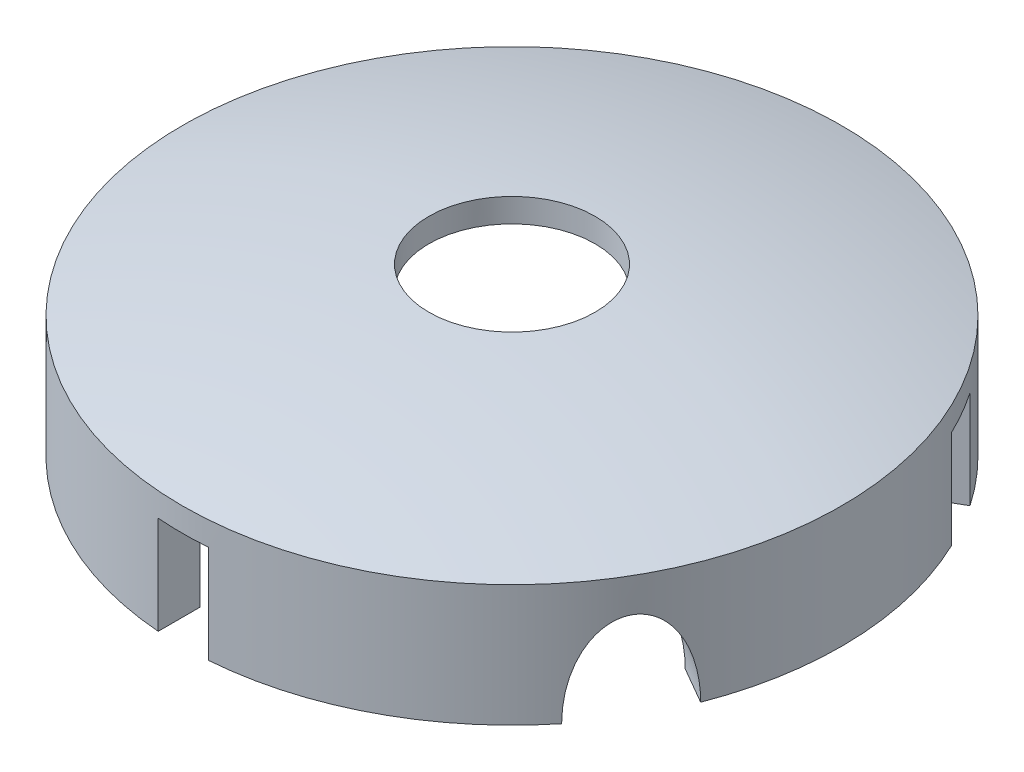
from build123d import *
from build123d.topology import SkipClean

# Parameters (mm, degrees)
SKETCH2_R           = 44.05249
BOSS_EXTRUDE1_DEPTH = 3.175
SKETCH4_R           = 44.45
SKETCH4_R_2         = 38.496875
BOSS_EXTRUDE2_DEPTH = 13.09624
SKETCH5_W           = 6.74624
SKETCH5_H           = 50.081304553
CUT_EXTRUDE1_DEPTH  = 65.211498208
CIRPATTERN1_COUNT   = 3
DOME1_FACE_RADIUS   = 44.05249
DOME1_HEIGHT        = 6.35
SKETCH11_R          = 11.1125
CUT_EXTRUDE4_DEPTH  = 65.211498208
SKETCH12_R          = 44.45
SKETCH12_R_2        = 44.05249
CUT_EXTRUDE5_DEPTH  = 67.674963897
SKETCH13_RX         = 11.739123023
SKETCH13_RY         = 6.803403928
CUT_EXTRUDE6_DEPTH  = 64.661253935
CIRPATTERN2_COUNT   = 3


# Read off the part's stored shape, not the designer's step: Shell2
with BuildPart() as part:
    # Sketch2 → Boss-Extrude1 (new body)
    with BuildSketch(Plane(origin=(0, 0, 0), x_dir=(1, 0, 0), z_dir=(0, 1, 0))):
        with Locations(Location((0, 0, 0), (0, 0, 270))):
            Circle(SKETCH2_R)
    extrude(amount=BOSS_EXTRUDE1_DEPTH)

    # Sketch4 → Boss-Extrude2 (add)
    with BuildSketch(Plane.XZ):
        with Locations(Location((0, 0, 0), (0, 0, 270))):
            Circle(SKETCH4_R)
        with Locations(Location((0, 0, 0), (0, 0, 270))):
            Circle(SKETCH4_R_2, mode=Mode.SUBTRACT)
    extrude(amount=BOSS_EXTRUDE2_DEPTH)

    # Sketch5 → Cut-Extrude1 (cut, through all)
    with BuildSketch(Plane.XZ):
        with Locations((0, 25.040652277)):
            Rectangle(SKETCH5_W, SKETCH5_H)
    cut_extrude1 = extrude(amount=CUT_EXTRUDE1_DEPTH, mode=Mode.SUBTRACT)

    # CirPattern1: Cut-Extrude1 ×3 about axis
    cirpattern1_axis = Axis((0, 0, 0), (0, 1, 0))
    for i in range(1, CIRPATTERN1_COUNT):
        add(cut_extrude1.rotate(cirpattern1_axis, i * 360 / CIRPATTERN1_COUNT), mode=Mode.SUBTRACT)

    # Dome1: a dome of height H over a round flat face of radius A is a cap of a sphere of radius (A * A + H * H) / (2 * H)
    dome1_r = (DOME1_FACE_RADIUS * DOME1_FACE_RADIUS + DOME1_HEIGHT * DOME1_HEIGHT) / (2 * DOME1_HEIGHT)
    dome1_base = Plane((0, 3.175, 0), z_dir=(0, 1, 0))
    with Locations(dome1_base.offset(DOME1_HEIGHT - dome1_r)):
        dome1_ball = Sphere(dome1_r, mode=Mode.PRIVATE)
    add(split(dome1_ball, bisect_by=dome1_base, keep=Keep.TOP, mode=Mode.PRIVATE))

    # Shell2 outline → Shell2 (revolve, cut)
    with BuildSketch(Plane.XY):
        with BuildLine():
            Line((0, 0), (40.87749, 0))
            Line((40.87749, 0), (40.877490147, 0.780856364))
            ThreePointArc((40.877490147, 0.780856364), (20.62755779, 4.951312704), (0, 6.35))
            Line((0, 6.35), (0, 0))
        make_face()
    revolve(axis=Axis((0, 0, 0), (0, 1, 0)), mode=Mode.SUBTRACT)

    # Sketch11 → Cut-Extrude4 (cut, through all)
    with BuildSketch(Plane(origin=(0, 0, 0), x_dir=(1, 0, 0), z_dir=(0, 1, 0))):
        with Locations(Location((0, 0, 0), (0, 0, 90))):
            Circle(SKETCH11_R)
    extrude(amount=CUT_EXTRUDE4_DEPTH, mode=Mode.SUBTRACT)

    # Sketch12 → Cut-Extrude5 (cut, through all)
    with SkipClean():  # the faces are left unmerged after this step: merging them gives an invalid solid
        with BuildSketch(Plane.XZ.offset(13.09624)):
            Circle(SKETCH12_R)
            with Locations(Location((0, 0, 0), (0, 0, 325.608536688))):
                Circle(SKETCH12_R_2, mode=Mode.SUBTRACT)
        extrude(amount=-CUT_EXTRUDE5_DEPTH, mode=Mode.SUBTRACT)

    # Sketch13 → Cut-Extrude6 (cut, through all)
    with SkipClean():  # the faces are left unmerged after this step: merging them gives an invalid solid
        with BuildSketch(Plane.XY):
            with Locations(Location((0, -13.09624), (0, 0, 90))):
                Ellipse(SKETCH13_RX, SKETCH13_RY)
        cut_extrude6 = extrude(amount=-CUT_EXTRUDE6_DEPTH, mode=Mode.SUBTRACT)

    # CirPattern2: Cut-Extrude6 ×3 about axis
    with SkipClean():  # the faces are left unmerged after this step: merging them gives an invalid solid
        cirpattern2_axis = Axis((0, 3.175, 0), (0, -1, 0))
        for i in range(1, CIRPATTERN2_COUNT):
            add(cut_extrude6.rotate(cirpattern2_axis, i * 360 / CIRPATTERN2_COUNT), mode=Mode.SUBTRACT)


solid = part.part
